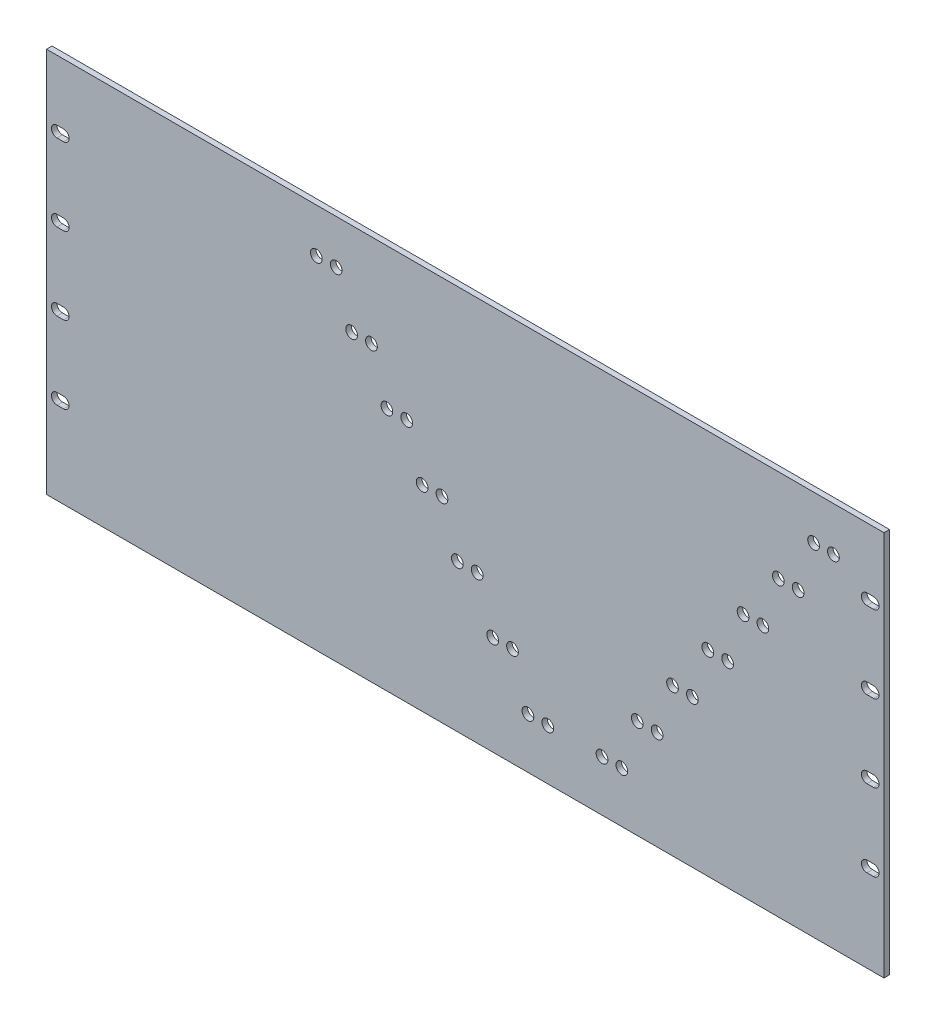
from build123d import *

# Parameters (mm, degrees)
SKETCH1_W                           = 482.6
SKETCH1_H                           = 222.25
BOSS_EXTRUDE1_DEPTH                 = 3.175
F_1_4_CLEARANCE_HOLE1_D             = 6.7564
F_1_4_CLEARANCE_HOLE1_DEPTH         = 19.05
F_1_4_CLEARANCE_HOLE1_TIP           = 2.029827343
TAP_DRILL_SLOT_FOR_10_24_TAP1_DEPTH = 3.175


# Read off the part's stored shape, not the designer's step: Tap Drill Slot for #10-24 Tap1
with BuildPart() as part:
    # Sketch1 → Boss-Extrude1 (new body)
    with BuildSketch(Plane.XY):
        with Locations((241.3, 111.125)):
            Rectangle(SKETCH1_W, SKETCH1_H)
    extrude(amount=BOSS_EXTRUDE1_DEPTH)

    # 1/4 Clearance Hole1
    with Locations(Plane(origin=(-396.999136144, -1332.621924612, 0), x_dir=(-1, 0, 0), z_dir=(0, 0, -1))):
        with Locations((-850.467876144, 1529.471924612), (-839.037876144, 1529.471924612), (-830.147876144, 1501.531924612), (-818.717876144, 1501.531924612), (-809.827876144, 1473.591924612), (-798.397876144, 1473.591924612), (-789.507876144, 1445.651924612), (-778.077876144, 1445.651924612), (-769.187876144, 1417.711924612), (-757.757876144, 1417.711924612), (-748.867876144, 1389.771924612), (-737.437876144, 1389.771924612), (-728.547876144, 1361.831924612), (-717.117876144, 1361.831924612), (-685.844126144, 1361.831924612), (-674.414126144, 1361.831924612), (-665.524126144, 1389.771924612), (-654.094126144, 1389.771924612), (-645.204126144, 1417.711924612), (-633.774126144, 1417.711924612), (-624.884126144, 1445.651924612), (-613.454126144, 1445.651924612), (-604.564126144, 1473.591924612), (-593.134126144, 1473.591924612), (-584.244126144, 1501.531924612), (-572.814126144, 1501.531924612), (-563.924126144, 1529.471924612), (-552.494126144, 1529.471924612)):
            Hole(F_1_4_CLEARANCE_HOLE1_D / 2, depth=F_1_4_CLEARANCE_HOLE1_DEPTH)
            with Locations((0, 0, -(F_1_4_CLEARANCE_HOLE1_DEPTH + F_1_4_CLEARANCE_HOLE1_TIP / 2))):  # 118° drill point
                Cone(0, F_1_4_CLEARANCE_HOLE1_D / 2, F_1_4_CLEARANCE_HOLE1_TIP, mode=Mode.SUBTRACT)

    # Tap Drill Slot for #10-24 Tap1 outline → Tap Drill Slot for #10-24 Tap1 (cut)
    with BuildSketch(Plane.XY):
        with BuildLine():
            Line((472.7702, 180.975), (476.5802, 180.975))
            ThreePointArc((476.5802, 180.975), (479.7552, 184.15), (476.5802, 187.325))
            Line((476.5802, 187.325), (472.7702, 187.325))
            ThreePointArc((472.7702, 187.325), (469.5952, 184.15), (472.7702, 180.975))
        make_face()
        with BuildLine():
            ThreePointArc((9.8298, 180.975), (13.0048, 184.15), (9.8298, 187.325))
            Line((9.8298, 187.325), (6.0198, 187.325))
            ThreePointArc((6.0198, 187.325), (2.8448, 184.15), (6.0198, 180.975))
            Line((6.0198, 180.975), (9.8298, 180.975))
        make_face()
        with BuildLine():
            Line((472.7702, 136.525), (476.5802, 136.525))
            ThreePointArc((476.5802, 136.525), (479.7552, 139.7), (476.5802, 142.875))
            Line((476.5802, 142.875), (472.7702, 142.875))
            ThreePointArc((472.7702, 142.875), (469.5952, 139.7), (472.7702, 136.525))
        make_face()
        with BuildLine():
            ThreePointArc((9.8298, 136.525), (13.0048, 139.7), (9.8298, 142.875))
            Line((9.8298, 142.875), (6.0198, 142.875))
            ThreePointArc((6.0198, 142.875), (2.8448, 139.7), (6.0198, 136.525))
            Line((6.0198, 136.525), (9.8298, 136.525))
        make_face()
        with BuildLine():
            Line((472.7702, 92.075), (476.5802, 92.075))
            ThreePointArc((476.5802, 92.075), (479.7552, 95.25), (476.5802, 98.425))
            Line((476.5802, 98.425), (472.7702, 98.425))
            ThreePointArc((472.7702, 98.425), (469.5952, 95.25), (472.7702, 92.075))
        make_face()
        with BuildLine():
            ThreePointArc((9.8298, 92.075), (13.0048, 95.25), (9.8298, 98.425))
            Line((9.8298, 98.425), (6.0198, 98.425))
            ThreePointArc((6.0198, 98.425), (2.8448, 95.25), (6.0198, 92.075))
            Line((6.0198, 92.075), (9.8298, 92.075))
        make_face()
        with BuildLine():
            Line((472.7702, 47.625), (476.5802, 47.625))
            ThreePointArc((476.5802, 47.625), (479.7552, 50.8), (476.5802, 53.975))
            Line((476.5802, 53.975), (472.7702, 53.975))
            ThreePointArc((472.7702, 53.975), (469.5952, 50.8), (472.7702, 47.625))
        make_face()
        with BuildLine():
            ThreePointArc((9.8298, 47.625), (13.0048, 50.8), (9.8298, 53.975))
            Line((9.8298, 53.975), (6.0198, 53.975))
            ThreePointArc((6.0198, 53.975), (2.8448, 50.8), (6.0198, 47.625))
            Line((6.0198, 47.625), (9.8298, 47.625))
        make_face()
    extrude(amount=TAP_DRILL_SLOT_FOR_10_24_TAP1_DEPTH, mode=Mode.SUBTRACT)


solid = part.part
